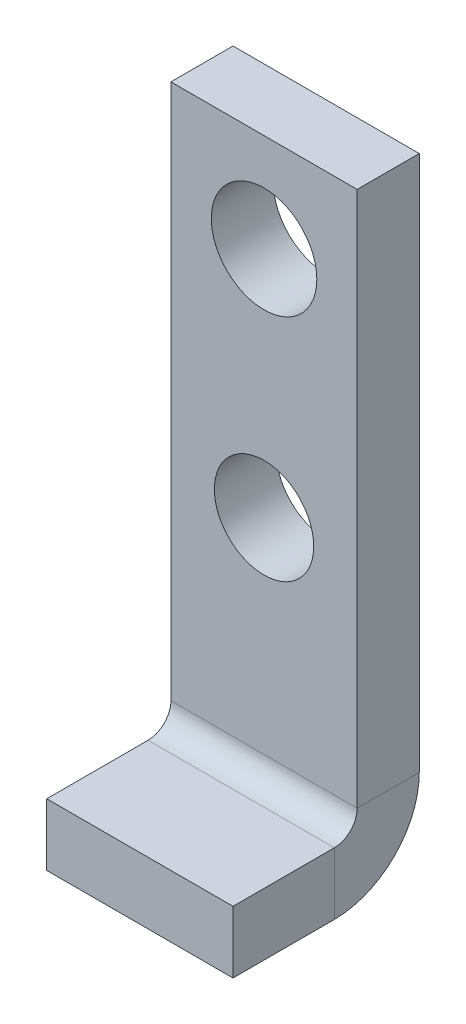
from build123d import *

# Parameters (mm, degrees)
SKETCH_1_W                       = 6
SKETCH_1_H                       = 18
SKETCH_1_R                       = 1.6
SKETCH_1_R_2                     = 1.7
SM_BASE_FLANGE_1_DEPTH           = 2
SM_EDGE_FLANGE_1_STRIP_W         = 9.4732
SM_EDGE_FLANGE_1_STRIP_H         = 2
SM_EDGE_FLANGE_1_STRIP_CUT_DEPTH = 6
SM_EDGE_FLANGE_1_DEPTH           = 6


# Sheet-metal steps are written as plain solids
with BuildPart() as part:
    # Sketch 1 → Базовая кромка1 (new body)
    with BuildSketch(Plane.XY):
        with Locations((0, 1.659676661)):
            Rectangle(SKETCH_1_W, SKETCH_1_H)
        Circle(SKETCH_1_R, mode=Mode.SUBTRACT)
        with Locations((0, 7.5)):
            Circle(SKETCH_1_R_2, mode=Mode.SUBTRACT)
    extrude(amount=-SM_BASE_FLANGE_1_DEPTH)

    # Ребро-кромка1 strip (across the edge) → Ребро-кромка1 strip cut (cut)
    with BuildSketch(Plane(origin=(-3, -7.340323339, 0), x_dir=(0, 1, 0), z_dir=(1, 0, 0))):
        with Locations((-4, -1)):
            Rectangle(SM_EDGE_FLANGE_1_STRIP_W, SM_EDGE_FLANGE_1_STRIP_H)
    extrude(amount=SM_EDGE_FLANGE_1_STRIP_CUT_DEPTH, mode=Mode.SUBTRACT)

    # Ребро-кромка1 section (across the edge) → Ребро-кромка1 (add)
    with BuildSketch(Plane(origin=(-3, -7.340323339, 0), x_dir=(0, 1, 0), z_dir=(1, 0, 0))):
        with BuildLine():
            Line((-2, 0.7366), (-2, 4))
            Line((-2, 4), (0, 4))
            Line((0, 4), (0, 0.7366))
            ThreePointArc((0, 0.7366), (0.215745145, 0.215745145), (0.7366, 0))
            Line((0.7366, 0), (0.7366, -2))
            ThreePointArc((0.7366, -2), (-1.198468417, -1.198468417), (-2, 0.7366))
        make_face()
    extrude(amount=SM_EDGE_FLANGE_1_DEPTH)


solid = part.part
